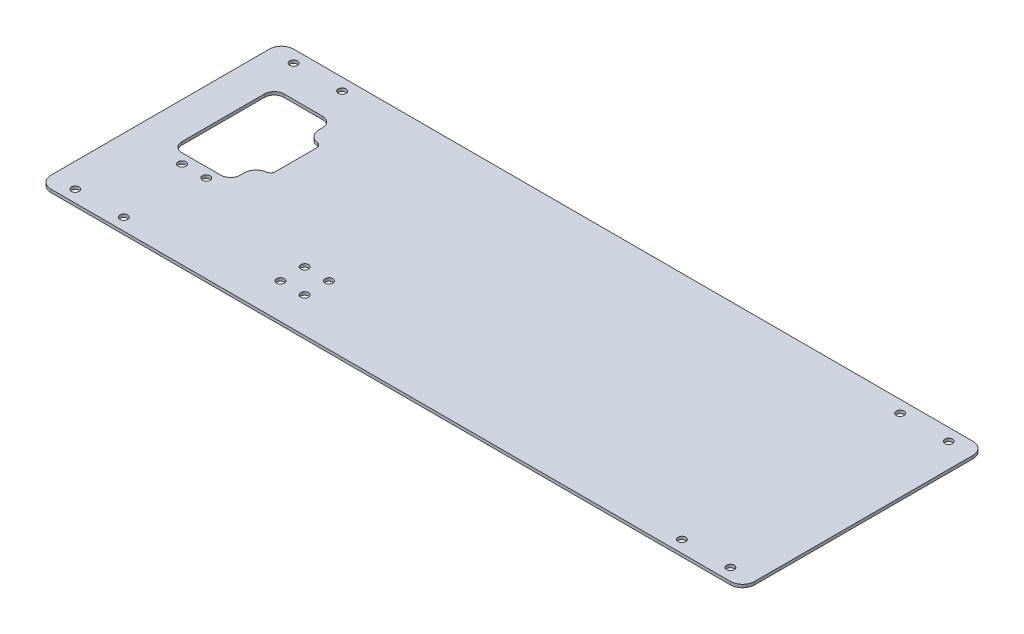
from build123d import *

# Parameters (mm, degrees)
SKETCH1_W           = 368.3
SKETCH1_H           = 127
SKETCH1_R           = 2.032
BOSS_EXTRUDE1_DEPTH = 1.5875
FILLET1_R           = 5.08
FILLET3_R           = 6.35
FILLET4_R           = 2.54
FILLET5_R           = 6.35


with BuildPart() as part:
    # Sketch1 → Boss-Extrude1 (new body)
    with BuildSketch(Plane(origin=(0, 0, 0), x_dir=(1, 0, 0), z_dir=(0, 1, 0))):
        Rectangle(SKETCH1_W, SKETCH1_H)
        with Locations((-171.45, -57.15)):
            Circle(SKETCH1_R, mode=Mode.SUBTRACT)
        with Locations((-146.05, -57.15)):
            Circle(SKETCH1_R, mode=Mode.SUBTRACT)
        with Locations((-76.2, -45.0215)):
            Circle(SKETCH1_R, mode=Mode.SUBTRACT)
        with Locations((-63.5, -45.0215)):
            Circle(SKETCH1_R, mode=Mode.SUBTRACT)
        with Locations((-76.2, -32.3215)):
            Circle(SKETCH1_R, mode=Mode.SUBTRACT)
        with Locations((-63.5, -32.3215)):
            Circle(SKETCH1_R, mode=Mode.SUBTRACT)
        with Locations((-154.94, -17.78)):
            Circle(SKETCH1_R, mode=Mode.SUBTRACT)
        with Locations((-142.24, -17.78)):
            Circle(SKETCH1_R, mode=Mode.SUBTRACT)
        with Locations((146.05, -57.15)):
            Circle(SKETCH1_R, mode=Mode.SUBTRACT)
        with Locations((171.45, -57.15)):
            Circle(SKETCH1_R, mode=Mode.SUBTRACT)
        Polygon((-134.62, -12.7), (-165.1, -12.7), (-165.1, 40.64), (-134.62, 40.64), (-134.62, 27.305), (-127, 27.305), (-127, 0.635), (-134.62, 0.635), align=None, mode=Mode.SUBTRACT)
        with Locations((-171.45, 57.15)):
            Circle(SKETCH1_R, mode=Mode.SUBTRACT)
        with Locations((-146.05, 57.15)):
            Circle(SKETCH1_R, mode=Mode.SUBTRACT)
        with Locations((146.05, 57.15)):
            Circle(SKETCH1_R, mode=Mode.SUBTRACT)
        with Locations((171.45, 57.15)):
            Circle(SKETCH1_R, mode=Mode.SUBTRACT)
    extrude(amount=BOSS_EXTRUDE1_DEPTH)

    # Fillet1
    fillet1_edges = [part.edges().sort_by_distance(p)[0] for p in [
        (-134.62, 0.79375, 12.7),
        (-165.1, 0.79375, 12.7),
        (-165.1, 0.79375, -40.64),
        (-134.62, 0.79375, -40.64),
    ]]
    fillet(fillet1_edges, radius=FILLET1_R)

    # Fillet3
    fillet3_edges = [part.edges().sort_by_distance(p)[0] for p in [
        (184.15, 0.79375, 63.5),
        (184.15, 0.79375, -63.5),
        (-184.15, 0.79375, 63.5),
        (-184.15, 0.79375, -63.5),
    ]]
    fillet(fillet3_edges, radius=FILLET3_R)

    # Fillet4
    fillet4_edges = [part.edges().sort_by_distance(p)[0] for p in [
        (-127, 0.79375, -0.635),
        (-127, 0.79375, -27.305),
    ]]
    fillet(fillet4_edges, radius=FILLET4_R)

    # Fillet5
    fillet5_edges = [part.edges().sort_by_distance(p)[0] for p in [
        (-134.62, 0.79375, -0.635),
        (-134.62, 0.79375, -27.305),
    ]]
    fillet(fillet5_edges, radius=FILLET5_R)


solid = part.part
